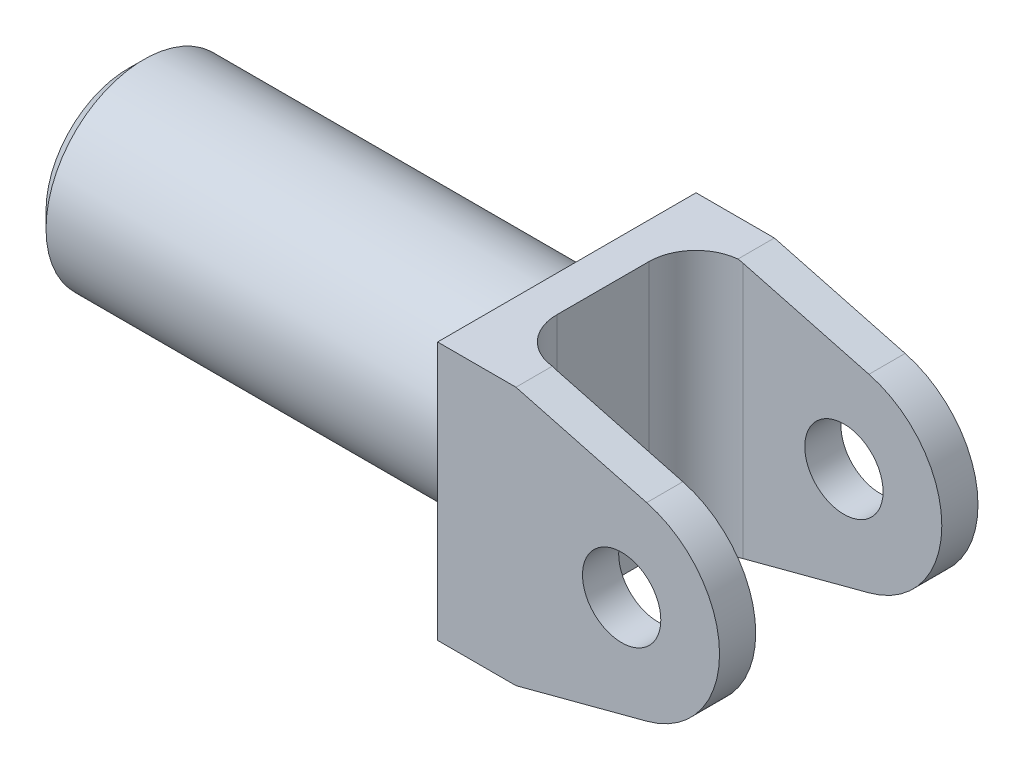
from build123d import *

# Parameters (mm, degrees)
SKETCH1_W               = 22.86
SKETCH1_H               = 20.955
BOSS_EXTRUDE1_DEPTH     = 10.4775
CUT_EXTRUDE1_DEPTH      = 33.733310729
CUT_EXTRUDE1_DEPTH_BACK = 33.733310729
CUT_EXTRUDE2_DEPTH      = 33.733310729
SKETCH4_R               = 7.9375
BOSS_EXTRUDE2_DEPTH     = 35.56
SKETCH5_R               = 4.7625
CUT_EXTRUDE3_DEPTH      = 31.242
FILLET1_R               = 2.54
CHAMFER1_SIZE           = 1.27


with BuildPart() as part:
    # Sketch1 → Boss-Extrude1 (new, symmetric)
    with BuildSketch(Plane(origin=(0, 0, 0), x_dir=(1, 0, 0), z_dir=(0, 1, 0))):
        with Locations((11.43, 0)):
            Rectangle(SKETCH1_W, SKETCH1_H)
    extrude(amount=BOSS_EXTRUDE1_DEPTH, both=True)

    # Sketch2 → Cut-Extrude1 (cut, two sides: drawn at the far end of the back side and taken through both)
    with BuildSketch(Plane(origin=(0, 10.4775, 0), x_dir=(1, 0, 0), z_dir=(0, 1, 0)).offset(-CUT_EXTRUDE1_DEPTH_BACK)):
        with BuildLine():
            Line((2.921, 3.7338), (2.921, -3.7338))
            ThreePointArc((2.921, -3.7338), (4.036923164, -6.427876836), (6.731, -7.5438))
            Line((6.731, -7.5438), (22.86, -7.5438))
            Line((22.86, -7.5438), (22.86, 7.5438))
            Line((22.86, 7.5438), (6.731, 7.5438))
            ThreePointArc((6.731, 7.5438), (4.036923164, 6.427876836), (2.921, 3.7338))
        make_face()
    extrude(amount=CUT_EXTRUDE1_DEPTH + CUT_EXTRUDE1_DEPTH_BACK, mode=Mode.SUBTRACT)

    # Sketch3 → Cut-Extrude2 (cut, through all)
    with BuildSketch(Plane.XY.offset(10.4775)):
        with BuildLine():
            ThreePointArc((16.951908562, 7.673682763), (21.211869472, 4.842286433), (22.86, 0))
            Line((22.86, 0), (22.86, 10.4775))
            Line((22.86, 10.4775), (6.35, 10.4775))
            Line((6.35, 10.4775), (16.951908562, 7.673682763))
        make_face()
        with BuildLine():
            Line((22.86, -10.4775), (22.86, 0))
            ThreePointArc((22.86, 0), (21.211869472, -4.842286433), (16.951908562, -7.673682763))
            Line((16.951908562, -7.673682763), (6.35, -10.4775))
            Line((6.35, -10.4775), (22.86, -10.4775))
        make_face()
        with BuildLine():
            ThreePointArc((18.0975, 0), (14.9225, 3.175), (11.7475, 0))
            Line((11.7475, 0), (18.0975, 0))
        make_face()
        with BuildLine():
            Line((18.0975, 0), (11.7475, 0))
            ThreePointArc((11.7475, 0), (14.9225, -3.175), (18.0975, 0))
        make_face()
    extrude(amount=-CUT_EXTRUDE2_DEPTH, mode=Mode.SUBTRACT)

    # Sketch4 → Boss-Extrude2 (add)
    with BuildSketch(Plane.ZY):
        with Locations(Location((0, 0, 0), (0, 0, 180))):
            Circle(SKETCH4_R)
    extrude(amount=BOSS_EXTRUDE2_DEPTH)

    # Sketch5 → Cut-Extrude3 (cut)
    with BuildSketch(Plane.ZY.offset(35.56)):
        Circle(SKETCH5_R)
    extrude(amount=-CUT_EXTRUDE3_DEPTH, mode=Mode.SUBTRACT)

    # Fillet1
    fillet1_edges = [part.edges().sort_by_distance(p)[0] for p in [
        (0, 0, 7.9375),
    ]]
    fillet(fillet1_edges, radius=FILLET1_R - 0.0001)  # a hair under: the kernel refuses the full size

    # Chamfer1
    chamfer1_edges = [part.edges().sort_by_distance(p)[0] for p in [
        (-35.56, 0, 7.9375),
    ]]
    chamfer(chamfer1_edges, length=CHAMFER1_SIZE)


solid = part.part
